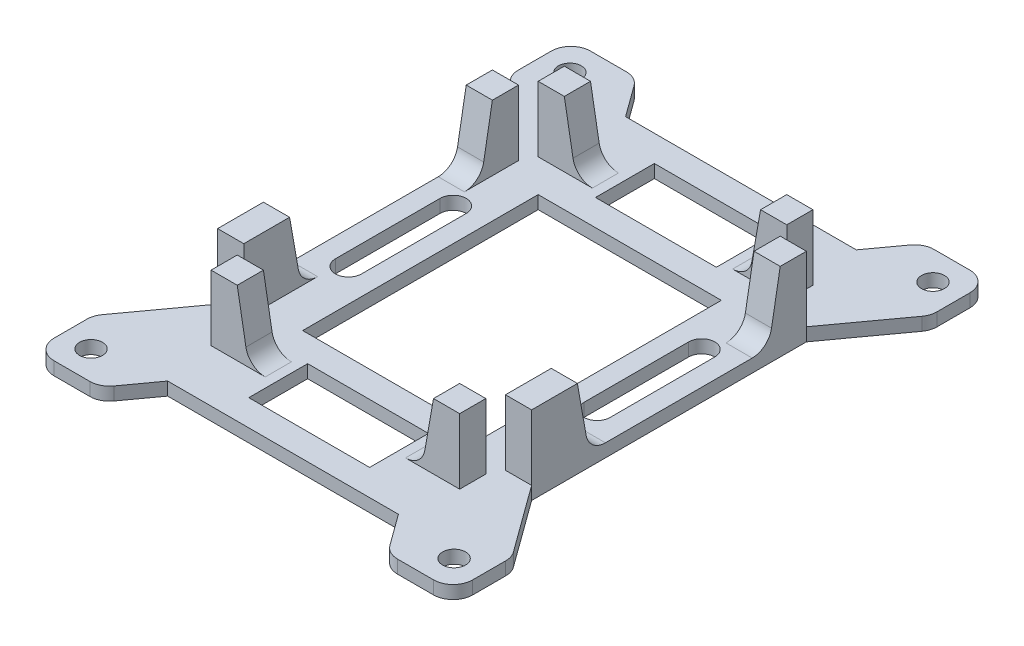
from build123d import *

# Parameters (mm, degrees)
SKETCH1_W           = 64
SKETCH1_H           = 82
SKETCH1_R           = 1.75
SKETCH1_W_2         = 28
SKETCH1_H_2         = 36
BOSS_EXTRUDE1_DEPTH = 2
SKETCH4_W           = 4
SKETCH4_H           = 4
SKETCH4_H_2         = 7
BOSS_EXTRUDE2_DEPTH = 10
CUT_EXTRUDE1_DEPTH  = 53.962250707
DRAFT12_ANGLE       = 10
DRAFT13_ANGLE       = 10
SKETCH6_W           = 18.473460386
SKETCH6_H           = 9
CUT_EXTRUDE2_DEPTH  = 53.962250707
FILLET1_R           = 3
FILLET2_R           = 3


with BuildPart() as part:
    # Sketch1 → Boss-Extrude1 (new body)
    with BuildSketch(Plane(origin=(0, 0, 0), x_dir=(1, 0, 0), z_dir=(0, 1, 0))):
        Rectangle(SKETCH1_W, SKETCH1_H)
        with Locations((27.75, -36.6)):
            Circle(SKETCH1_R, mode=Mode.SUBTRACT)
        with Locations((-27.75, -36.6)):
            Circle(SKETCH1_R, mode=Mode.SUBTRACT)
        with Locations((-27.75, 36.6)):
            Circle(SKETCH1_R, mode=Mode.SUBTRACT)
        with Locations((27.75, 36.6)):
            Circle(SKETCH1_R, mode=Mode.SUBTRACT)
        Rectangle(SKETCH1_W_2, SKETCH1_H_2, mode=Mode.SUBTRACT)
    extrude(amount=BOSS_EXTRUDE1_DEPTH)

    # Sketch4 → Boss-Extrude2 (add)
    with BuildSketch(Plane(origin=(0, 2, 0), x_dir=(1, 0, 0), z_dir=(0, 1, 0))):
        with Locations((-17, -25)):
            Rectangle(SKETCH4_W, SKETCH4_H)
        with Locations((17, -25)):
            Rectangle(SKETCH4_W, SKETCH4_H)
        with Locations((-17, 25)):
            Rectangle(SKETCH4_W, SKETCH4_H)
        with Locations((17, 25)):
            Rectangle(SKETCH4_W, SKETCH4_H)
        with Locations((-22, -17.5)):
            Rectangle(SKETCH4_W, SKETCH4_H_2)
        with Locations((22, -17.5)):
            Rectangle(SKETCH4_W, SKETCH4_H_2)
        with Locations((-22, 19)):
            Rectangle(SKETCH4_W, SKETCH4_H)
        with Locations((22, 19)):
            Rectangle(SKETCH4_W, SKETCH4_H)
    extrude(amount=BOSS_EXTRUDE2_DEPTH)

    # Sketch5 → Cut-Extrude1 (cut, through all)
    with BuildSketch(Plane(origin=(0, 2, 0), x_dir=(1, 0, 0), z_dir=(0, 1, 0))):
        Polygon((-32, 32), (-24, 21), (-24, -21), (-32, -32), align=None)
        Polygon((32, -32), (24, -21), (24, 21), (32, 32), align=None)
    extrude(amount=-CUT_EXTRUDE1_DEPTH, mode=Mode.SUBTRACT)

    # Draft12
    draft12_faces = [part.faces().sort_by_distance(p)[0] for p in [
        (22, 7, 14),
        (22, 7, -17),
        (-22, 7, 14),
        (-22, 7, -17),
    ]]
    draft(draft12_faces, Plane.ZX.offset(12), DRAFT12_ANGLE)

    # Draft13
    draft13_faces = [part.faces().sort_by_distance(p)[0] for p in [
        (15, 7, 25),
        (-15, 7, 25),
        (15, 7, -25),
        (-15, 7, -25),
    ]]
    draft(draft13_faces, Plane.ZX.offset(12), DRAFT13_ANGLE)

    # Sketch6 → Cut-Extrude2 (cut, through all)
    with BuildSketch(Plane(origin=(0, 2, 0), x_dir=(1, 0, 0), z_dir=(0, 1, 0))):
        Polygon((-22, 41), (-17.636363636, 35), (17.636363636, 35), (22, 41), align=None)
        with BuildLine():
            Line((17, 10), (17, -6))
            ThreePointArc((17, -6), (19, -8), (21, -6))
            Line((21, -6), (21, 10))
            ThreePointArc((21, 10), (19, 12), (17, 10))
        make_face()
        Polygon((22, -41), (17.636363636, -35), (-17.636363636, -35), (-22, -41), align=None)
        with Locations((0, 26.5)):
            Rectangle(SKETCH6_W, SKETCH6_H)
        with Locations((0, -26.5)):
            Rectangle(SKETCH6_W, SKETCH6_H)
        with BuildLine():
            Line((-17, 10), (-17, -6))
            ThreePointArc((-17, -6), (-19, -8), (-21, -6))
            Line((-21, -6), (-21, 10))
            ThreePointArc((-21, 10), (-19, 12), (-17, 10))
        make_face()
    extrude(amount=-CUT_EXTRUDE2_DEPTH, mode=Mode.SUBTRACT)

    # Fillet1
    fillet1_edges = [part.edges().sort_by_distance(p)[0] for p in [
        (-22, 1, -41),
        (22, 1, -41),
        (32, 1, -41),
        (32, 1, -32),
        (32, 1, 32),
        (32, 1, 41),
        (22, 1, 41),
        (-22, 1, 41),
        (-32, 1, 41),
        (-32, 1, 32),
        (-32, 1, -32),
        (-32, 1, -41),
    ]]
    fillet(fillet1_edges, radius=FILLET1_R)

    # Fillet2
    fillet2_edges = [part.edges().sort_by_distance(p)[0] for p in [
        (-13.236730193, 2, -25),
        (13.236730193, 2, -25),
        (22, 2, -15.236730193),
        (22, 2, 12.236730193),
        (13.236730193, 2, 25),
        (-13.236730193, 2, 25),
        (-22, 2, 12.236730193),
        (-22, 2, -15.236730193),
    ]]
    fillet(fillet2_edges, radius=FILLET2_R)


solid = part.part
